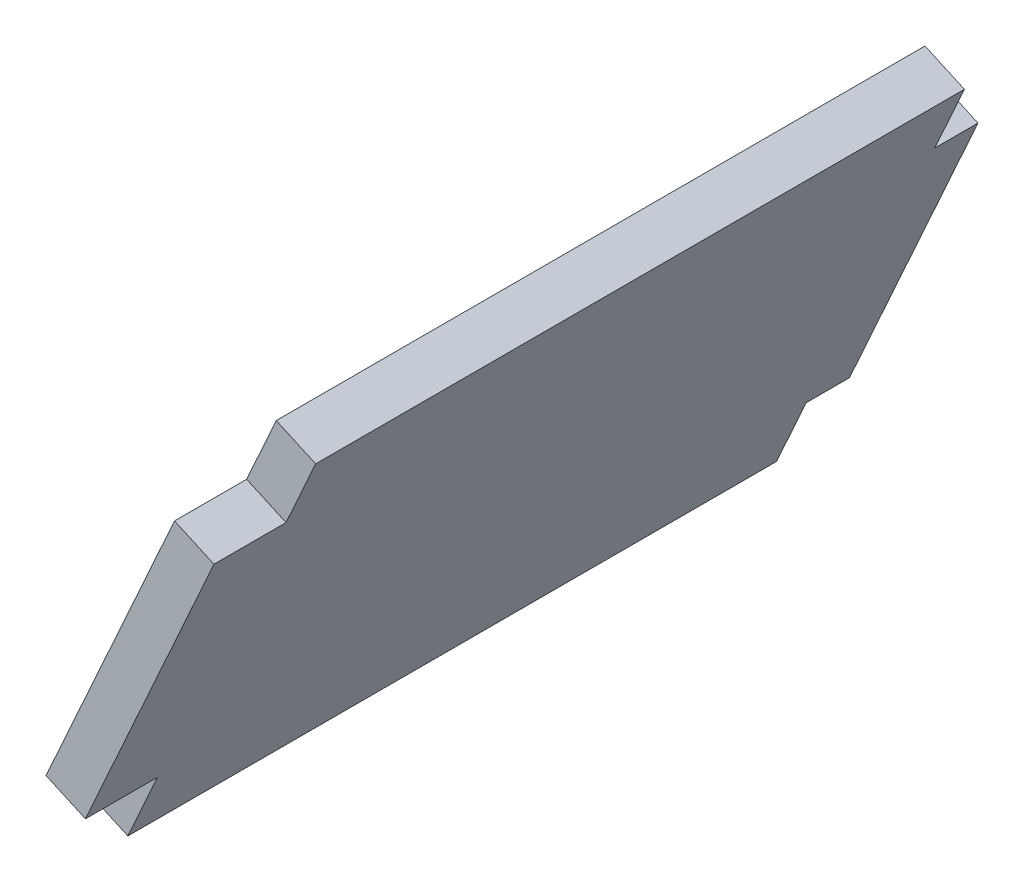
from build123d import *

# Parameters (mm, degrees)
ESTRUSIONE_ESTRUSIONE1_DEPTH      = 48
ESTRUSIONE_ESTRUSIONE1_DEPTH_BACK = 5
SCHIZZO2_W                        = 3
SCHIZZO2_H                        = 45
ESTRUSIONE_ESTRUSIONE2_DEPTH      = 5
CORPO_SPOSTA_COPIA1_START         = 29.517316332
CORPO_SPOSTA_COPIA1_OUTLINE_W     = 3
CORPO_SPOSTA_COPIA1_OUTLINE_H     = 43
CORPO_SPOSTA_COPIA1_DEPTH         = 31.678003798
CORPO_SPOSTA_COPIA1_2_OUTLINE_W   = 3
CORPO_SPOSTA_COPIA1_2_OUTLINE_H   = 5
CORPO_SPOSTA_COPIA1_2_DEPTH       = 5
CORPO_SPOSTA_COPIA1_START_2       = 56.19532013
CORPO_SPOSTA_COPIA1_3_OUTLINE_W   = 3
CORPO_SPOSTA_COPIA1_3_OUTLINE_H   = 5
CORPO_SPOSTA_COPIA1_3_DEPTH       = 5
CORPO_SPOSTA_COPIA1_4_OUTLINE_W   = 3
CORPO_SPOSTA_COPIA1_4_OUTLINE_H   = 45
CORPO_SPOSTA_COPIA1_4_DEPTH       = 31.678003798
CORPO_SPOSTA_COPIA1_START_3       = 34.517316332
CORPO_SPOSTA_COPIA1_5_OUTLINE_W   = 3
CORPO_SPOSTA_COPIA1_5_OUTLINE_H   = 3
CORPO_SPOSTA_COPIA1_5_DEPTH       = 21.678003798


# Read off the part's stored shape, not the designer's step: Corpo-Sposta/copia1
with BuildPart() as part:
    # Schizzo1 → Estrusione-Estrusione1 (new, two sides: drawn at the far end of the back side and taken through both)
    with BuildSketch(Plane.XY.offset(-ESTRUSIONE_ESTRUSIONE1_DEPTH_BACK)):
        Polygon((219.519084515, -37.421559693), (210.601374282, -57.180362615), (213.33577775, -58.414476741), (222.253487983, -38.655673819), align=None)
    extrude(amount=ESTRUSIONE_ESTRUSIONE1_DEPTH + ESTRUSIONE_ESTRUSIONE1_DEPTH_BACK)

    # Schizzo2 → Estrusione-Estrusione2 (add)
    with BuildSketch(Plane(origin=(23.117146118, 51.220226082, 0), x_dir=(0.9114678226482943, -0.41137137513052313, 0), z_dir=(0.41137137513052313, 0.9114678226482943, 0))):
        with Locations((216.978740463, -22.5)):
            Rectangle(SCHIZZO2_W, SCHIZZO2_H)
    estrusione_estrusione2 = extrude(amount=ESTRUSIONE_ESTRUSIONE2_DEPTH)

    # Specchia1: Estrusione-Estrusione2 across plane
    add(estrusione_estrusione2.mirror(Plane(origin=(18.658291002, 41.340824621, 0), x_dir=(0, 0, 1), z_dir=(0.41137137513052446, 0.9114678226482937, 0))))

    # Corpo-Sposta/copia1 outline → Corpo-Sposta/copia1 (cut)
    with BuildSketch(Plane(origin=(0, 0, 0), x_dir=(0.9114678226482965, -0.4113713751305183, 0), z_dir=(0.41137137513051825, 0.9114678226482965, 0)).offset(CORPO_SPOSTA_COPIA1_START)):
        with Locations((216.978740463, -26.5)):
            Rectangle(CORPO_SPOSTA_COPIA1_OUTLINE_W, CORPO_SPOSTA_COPIA1_OUTLINE_H)
    extrude(amount=CORPO_SPOSTA_COPIA1_DEPTH, mode=Mode.SUBTRACT)

    # Corpo-Sposta_copia1 2 outline → Corpo-Sposta_copia1 2 (cut)
    with BuildSketch(Plane(origin=(0, 0, 0), x_dir=(0.9114678226482965, -0.4113713751305183, 0), z_dir=(0.41137137513051825, 0.9114678226482965, 0)).offset(CORPO_SPOSTA_COPIA1_START)):
        with Locations((216.978740463, -2.5)):
            Rectangle(CORPO_SPOSTA_COPIA1_2_OUTLINE_W, CORPO_SPOSTA_COPIA1_2_OUTLINE_H)
    extrude(amount=CORPO_SPOSTA_COPIA1_2_DEPTH, mode=Mode.SUBTRACT)

    # Corpo-Sposta_copia1 3 outline → Corpo-Sposta_copia1 3 (cut)
    with BuildSketch(Plane(origin=(0, 0, 0), x_dir=(0.9114678226482965, -0.4113713751305183, 0), z_dir=(0.41137137513051825, 0.9114678226482965, 0)).offset(CORPO_SPOSTA_COPIA1_START_2)):
        with Locations((216.978740463, -2.5)):
            Rectangle(CORPO_SPOSTA_COPIA1_3_OUTLINE_W, CORPO_SPOSTA_COPIA1_3_OUTLINE_H)
    extrude(amount=CORPO_SPOSTA_COPIA1_3_DEPTH, mode=Mode.SUBTRACT)

    # Corpo-Sposta_copia1 4 outline → Corpo-Sposta_copia1 4 (add)
    with BuildSketch(Plane(origin=(0, 0, 0), x_dir=(0.9114678226482965, -0.4113713751305183, 0), z_dir=(0.41137137513051825, 0.9114678226482965, 0)).offset(CORPO_SPOSTA_COPIA1_START)):
        with Locations((216.978740463, 22.5)):
            Rectangle(CORPO_SPOSTA_COPIA1_4_OUTLINE_W, CORPO_SPOSTA_COPIA1_4_OUTLINE_H)
    extrude(amount=CORPO_SPOSTA_COPIA1_4_DEPTH)

    # Corpo-Sposta_copia1 5 outline → Corpo-Sposta_copia1 5 (add)
    with BuildSketch(Plane(origin=(0, 0, 0), x_dir=(0.9114678226482965, -0.4113713751305183, 0), z_dir=(0.41137137513051825, 0.9114678226482965, 0)).offset(CORPO_SPOSTA_COPIA1_START_3)):
        with Locations((216.978740463, 46.5)):
            Rectangle(CORPO_SPOSTA_COPIA1_5_OUTLINE_W, CORPO_SPOSTA_COPIA1_5_OUTLINE_H)
    extrude(amount=CORPO_SPOSTA_COPIA1_5_DEPTH)


solid = part.part
